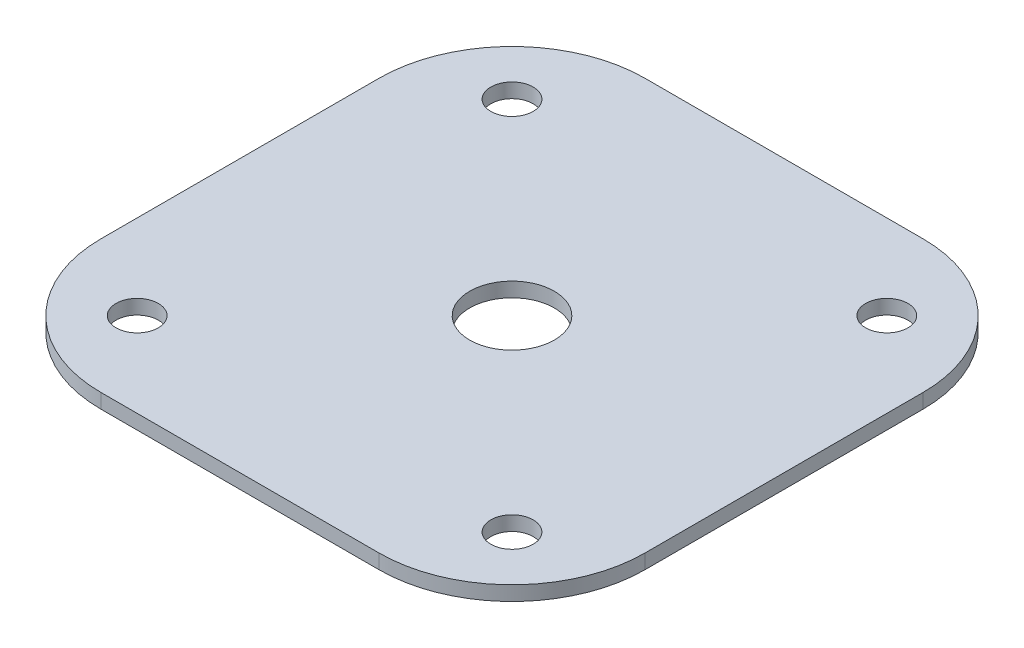
from build123d import *

# Parameters (mm, degrees)
SKETCH1_R           = 3.5
SKETCH1_R_2         = 1.75
BOSS_EXTRUDE1_DEPTH = 1.2


with BuildPart() as part:
    # Sketch1 → Boss-Extrude1 (new body)
    with BuildSketch(Plane(origin=(0, 0, 0), x_dir=(1, 0, 0), z_dir=(0, 1, 0))):
        with BuildLine():
            Line((-11.5, 22.5), (11.5, 22.5))
            ThreePointArc((11.5, 22.5), (19.278174593, 19.278174593), (22.5, 11.5))
            Line((22.5, 11.5), (22.5, -11.5))
            ThreePointArc((22.5, -11.5), (19.278174593, -19.278174593), (11.5, -22.5))
            Line((11.5, -22.5), (-11.5, -22.5))
            ThreePointArc((-11.5, -22.5), (-19.278174593, -19.278174593), (-22.5, -11.5))
            Line((-22.5, -11.5), (-22.5, 11.5))
            ThreePointArc((-22.5, 11.5), (-19.278174593, 19.278174593), (-11.5, 22.5))
        make_face()
        Circle(SKETCH1_R, mode=Mode.SUBTRACT)
        with Locations((-15.5, 15.5)):
            Circle(SKETCH1_R_2, mode=Mode.SUBTRACT)
        with Locations((15.5, 15.5)):
            Circle(SKETCH1_R_2, mode=Mode.SUBTRACT)
        with Locations((15.5, -15.5)):
            Circle(SKETCH1_R_2, mode=Mode.SUBTRACT)
        with Locations((-15.5, -15.5)):
            Circle(SKETCH1_R_2, mode=Mode.SUBTRACT)
    extrude(amount=BOSS_EXTRUDE1_DEPTH)


solid = part.part
